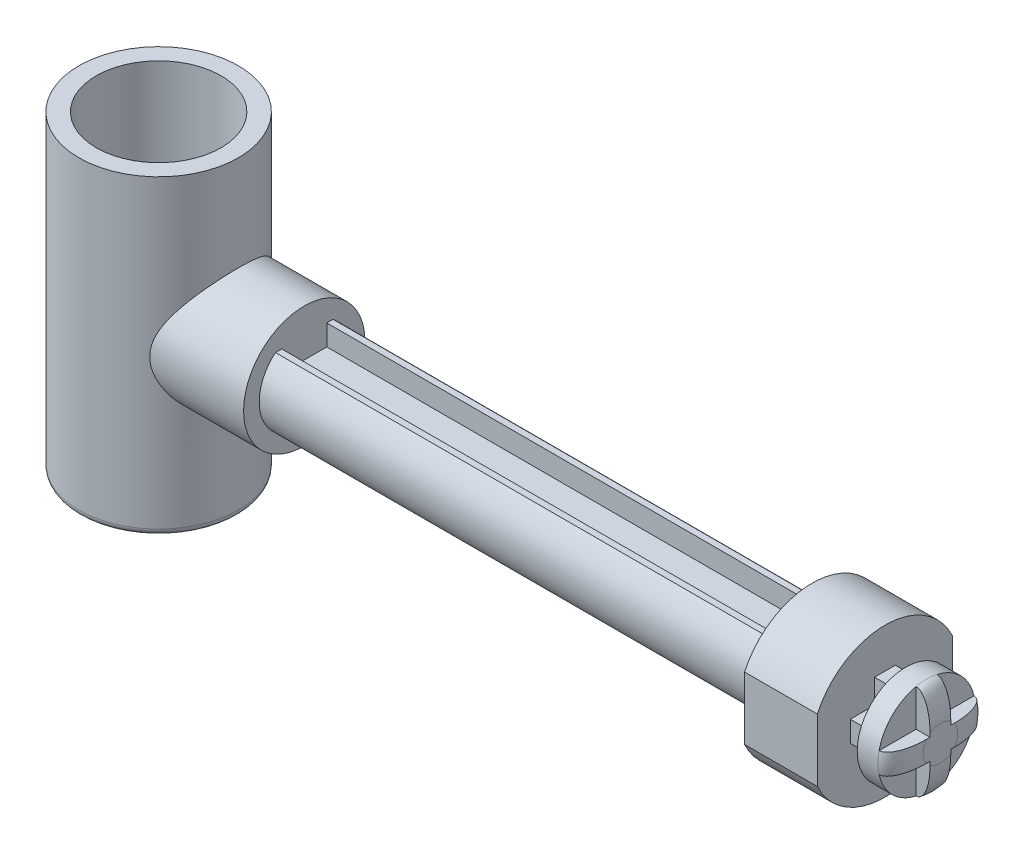
from build123d import *

# Parameters (mm, degrees)
SKETCH1_R           = 4.3
BOSS_EXTRUDE1_DEPTH = 4.2
SKETCH3_W           = 4
SKETCH3_H           = 1.2
SKETCH3_W_2         = 1.2
SKETCH3_H_2         = 4
BOSS_EXTRUDE2_DEPTH = 1.2
SKETCH4_R           = 2.8
BOSS_EXTRUDE3_DEPTH = 1.2
SKETCH5_W           = 1.2
SKETCH5_H           = 1.2
BOSS_EXTRUDE4_DEPTH = 0.8
FILLET1_SIZE        = 0.8
FILLET1_SIZE_2      = 1.8
SKETCH6_R           = 2.6
BOSS_EXTRUDE5_DEPTH = 29.3
SKETCH7_R           = 3.5
BOSS_EXTRUDE6_DEPTH = 5.4
SKETCH8_R           = 4.6
BOSS_EXTRUDE7_DEPTH = 9
SKETCH9_R           = 3.6
CUT_EXTRUDE1_DEPTH  = 16
SKETCH10_W          = 29.3
SKETCH10_H          = 4
CUT_EXTRUDE2_DEPTH  = 1.2
SKETCH11_W          = 29.3
SKETCH11_H          = 2.6
CUT_EXTRUDE3_DEPTH  = 1.2
FILLET2_R           = 0.4
SKETCH12_W          = 1
SKETCH12_H          = 12
CUT_EXTRUDE5_DEPTH  = 4.2


with BuildPart() as part:
    # Sketch1 → Boss-Extrude1 (new body)
    with BuildSketch(Plane(origin=(0, 0, 0), x_dir=(0, 0, -1), z_dir=(1, 0, 0))):
        Circle(SKETCH1_R)
    extrude(amount=BOSS_EXTRUDE1_DEPTH)

    # Sketch3 → Boss-Extrude2 (add)
    with BuildSketch(Plane(origin=(4.2, 0, 0), x_dir=(0, 0, -1), z_dir=(1, 0, 0))):
        Rectangle(SKETCH3_W, SKETCH3_H)
        Rectangle(SKETCH3_W_2, SKETCH3_H_2)
    extrude(amount=BOSS_EXTRUDE2_DEPTH)

    # Sketch4 → Boss-Extrude3 (add)
    with BuildSketch(Plane(origin=(5.4, 0, 0), x_dir=(0, 0, -1), z_dir=(1, 0, 0))):
        Circle(SKETCH4_R)
    extrude(amount=BOSS_EXTRUDE3_DEPTH)

    # Sketch5 → Boss-Extrude4 (add)
    with BuildSketch(Plane(origin=(6.6, 0, 0), x_dir=(0, 0, -1), z_dir=(1, 0, 0))):
        with BuildLine():
            Line((-2.734958866, -0.6), (-0.6, -0.6))
            Line((-0.6, -0.6), (-0.6, 0.6))
            Line((-0.6, 0.6), (-2.734958866, 0.6))
            ThreePointArc((-2.734958866, 0.6), (-2.783692227, 0.301757497), (-2.8, 0))
            ThreePointArc((-2.8, 0), (-2.783692227, -0.301757497), (-2.734958866, -0.6))
        make_face()
        with BuildLine():
            Line((-0.6, 0.6), (0.6, 0.6))
            Line((0.6, 0.6), (0.6, 2.734958866))
            ThreePointArc((0.6, 2.734958866), (0.301757497, 2.783692227), (0, 2.8))
            ThreePointArc((0, 2.8), (-0.301757497, 2.783692227), (-0.6, 2.734958866))
            Line((-0.6, 2.734958866), (-0.6, 0.6))
        make_face()
        with BuildLine():
            Line((0.6, -2.734958866), (0.6, -0.6))
            Line((0.6, -0.6), (-0.6, -0.6))
            Line((-0.6, -0.6), (-0.6, -2.734958866))
            ThreePointArc((-0.6, -2.734958866), (-0.301757497, -2.783692227), (0, -2.8))
            ThreePointArc((0, -2.8), (0.301757497, -2.783692227), (0.6, -2.734958866))
        make_face()
        with BuildLine():
            Line((0.6, -0.6), (2.734958866, -0.6))
            ThreePointArc((2.734958866, -0.6), (2.783692227, -0.301757497), (2.8, 0))
            ThreePointArc((2.8, 0), (2.783692227, 0.301757497), (2.734958866, 0.6))
            Line((2.734958866, 0.6), (0.6, 0.6))
            Line((0.6, 0.6), (0.6, -0.6))
        make_face()
        Rectangle(SKETCH5_W, SKETCH5_H)
    extrude(amount=BOSS_EXTRUDE4_DEPTH)

    # Fillet1
    # an asymmetric fillet: 1.8, 0.8 mm, written as the material it takes off along each edge
    with BuildSketch(Plane(origin=(7.4, 0, 0), x_dir=(0, 0.9683268920856462, 0.24968586276309931), z_dir=(0, -0.24968586276309931, 0.9683268920856462))) as fillet1_piece_1:
        with BuildLine():
            Bezier((2.8, FILLET1_SIZE), (2.8, 0), (2.8 - FILLET1_SIZE_2, 0), weights=[1, 0.707106781, 1])
            Line((2.8 - FILLET1_SIZE_2, 0), (2.8, 0))
            Line((2.8, 0), (2.8, FILLET1_SIZE))
        make_face()
    revolve(axis=Axis((7.4, 0, 0), (-1, 0, 0)), revolution_arc=208.917847895, mode=Mode.SUBTRACT)
    with BuildSketch(Plane(origin=(7.4, 0, 0), x_dir=(0, -0.968326892085652, -0.24968586276307686), z_dir=(0, 0.24968586276307686, -0.968326892085652))) as fillet1_piece_2:
        with BuildLine():
            Bezier((2.8, FILLET1_SIZE), (2.8, 0), (2.8 - FILLET1_SIZE_2, 0), weights=[1, 0.707106781, 1])
            Line((2.8 - FILLET1_SIZE_2, 0), (2.8, 0))
            Line((2.8, 0), (2.8, FILLET1_SIZE))
        make_face()
    revolve(axis=Axis((7.4, 0, 0), (-1, 0, 0)), revolution_arc=208.917847895, mode=Mode.SUBTRACT)
    with BuildSketch(Plane(origin=(7.4, 0, 0), x_dir=(0, 0.24968586276300908, -0.9683268920856695), z_dir=(0, 0.9683268920856695, 0.24968586276300908))) as fillet1_piece_3:
        with BuildLine():
            Bezier((2.8, FILLET1_SIZE), (2.8, 0), (2.8 - FILLET1_SIZE_2, 0), weights=[1, 0.707106781, 1])
            Line((2.8 - FILLET1_SIZE_2, 0), (2.8, 0))
            Line((2.8, 0), (2.8, FILLET1_SIZE))
        make_face()
    revolve(axis=Axis((7.4, 0, 0), (-1, 0, 0)), revolution_arc=208.917847895, mode=Mode.SUBTRACT)
    with BuildSketch(Plane(origin=(7.4, 0, 0), x_dir=(0, -0.24968586276311544, 0.968326892085642), z_dir=(0, -0.968326892085642, -0.24968586276311544))) as fillet1_piece_4:
        with BuildLine():
            Bezier((2.8, FILLET1_SIZE), (2.8, 0), (2.8 - FILLET1_SIZE_2, 0), weights=[1, 0.707106781, 1])
            Line((2.8 - FILLET1_SIZE_2, 0), (2.8, 0))
            Line((2.8, 0), (2.8, FILLET1_SIZE))
        make_face()
    revolve(axis=Axis((7.4, 0, 0), (-1, 0, 0)), revolution_arc=208.917847895, mode=Mode.SUBTRACT)

    # Sketch6 → Boss-Extrude5 (add)
    with BuildSketch(Plane.ZY):
        Circle(SKETCH6_R)
    extrude(amount=BOSS_EXTRUDE5_DEPTH)

    # Sketch7 → Boss-Extrude6 (add)
    with BuildSketch(Plane.ZY.offset(29.3)):
        with Locations(Location((0, 0, 0), (0, 0, 180))):
            Circle(SKETCH7_R)
    extrude(amount=BOSS_EXTRUDE6_DEPTH)

    # Sketch8 → Boss-Extrude7 (add, symmetric)
    with BuildSketch(Plane(origin=(0, 0, 0), x_dir=(1, 0, 0), z_dir=(0, 1, 0))):
        with Locations(Location((-37.7, 0, 0), (0, 0, 270))):
            Circle(SKETCH8_R)
    extrude(amount=BOSS_EXTRUDE7_DEPTH, both=True)

    # Sketch9 → Cut-Extrude1 (cut)
    with BuildSketch(Plane(origin=(0, 9, 0), x_dir=(1, 0, 0), z_dir=(0, 1, 0))):
        with Locations(Location((-37.7, 0, 0), (0, 0, 270))):
            Circle(SKETCH9_R)
    extrude(amount=-CUT_EXTRUDE1_DEPTH, mode=Mode.SUBTRACT)

    # Sketch10 → Cut-Extrude2 (cut)
    with BuildSketch(Plane(origin=(0, 2, 0), x_dir=(1, 0, 0), z_dir=(0, 1, 0))):
        with Locations((-14.65, 0)):
            Rectangle(SKETCH10_W, SKETCH10_H)
    cut_extrude2 = extrude(amount=CUT_EXTRUDE2_DEPTH, mode=Mode.SUBTRACT)

    # Sketch11 → Cut-Extrude3 (cut)
    with BuildSketch(Plane(origin=(0, 2, 0), x_dir=(1, 0, 0), z_dir=(0, 1, 0))):
        with Locations((-14.65, 0)):
            Rectangle(SKETCH11_W, SKETCH11_H)
    cut_extrude3 = extrude(amount=-CUT_EXTRUDE3_DEPTH, mode=Mode.SUBTRACT)

    # Mirror1: Cut-Extrude2, Cut-Extrude3 across plane
    add(cut_extrude2.mirror(Plane.ZX), mode=Mode.SUBTRACT)
    add(cut_extrude3.mirror(Plane.ZX), mode=Mode.SUBTRACT)

    # Fillet2
    fillet2_edges = [part.edges().sort_by_distance(p)[0] for p in [
        (-37.7, -9, -4.6),
    ]]
    fillet(fillet2_edges, radius=FILLET2_R)

    # Sketch12 → Cut-Extrude5 (cut)
    with BuildSketch(Plane(origin=(4.2, 0, 0), x_dir=(0, 0, -1), z_dir=(1, 0, 0))):
        with Locations((-4.4, 0)):
            Rectangle(SKETCH12_W, SKETCH12_H)
        with Locations((4.4, 0)):
            Rectangle(SKETCH12_W, SKETCH12_H)
    extrude(amount=-CUT_EXTRUDE5_DEPTH, mode=Mode.SUBTRACT)


solid = part.part
